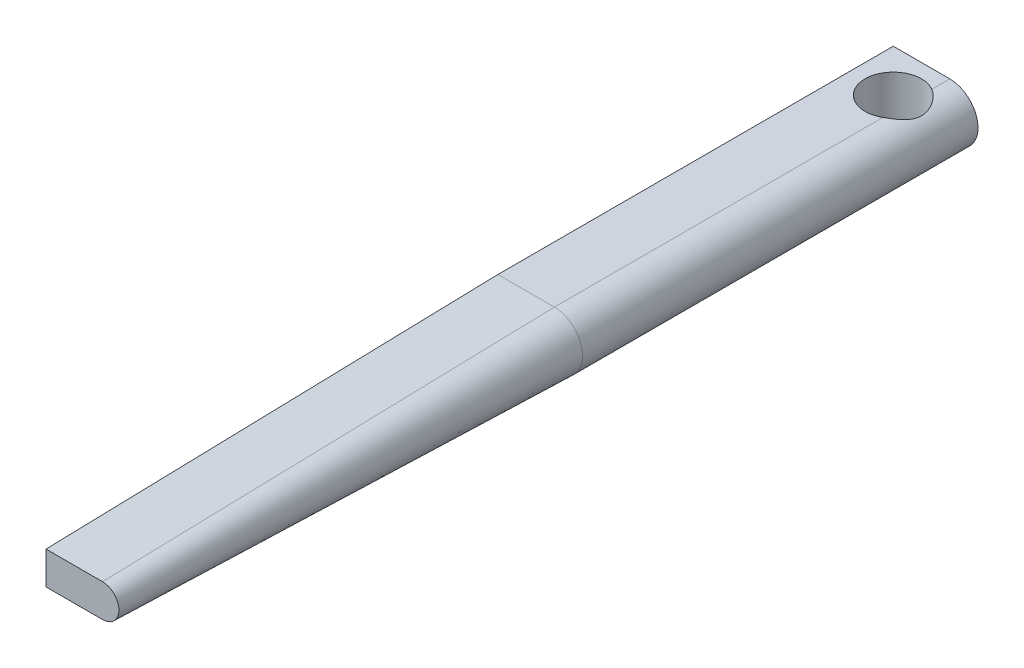
from build123d import *
from OCP.BRepFilletAPI import BRepFilletAPI_MakeChamfer

# Parameters (mm, degrees)
EXTRUDE_1_DEPTH     = 150
SKETCH_2_R          = 5
CUT_EXTRUDE_2_DEPTH = 152.079449297
CHAMFER_1_SIZE      = 80
CHAMFER_1_SIZE2     = 2.094873726


with BuildPart() as part:
    # 草图1 → 拉伸1 (new body)
    with BuildSketch(Plane.XY):
        with BuildLine():
            Line((0, 10), (10, 10))
            ThreePointArc((10, 10), (15, 5), (10, 0))
            Line((10, 0), (0, 0))
            Line((0, 0), (0, 10))
        make_face()
    extrude(amount=EXTRUDE_1_DEPTH)

    # 草图2 → 拉伸2 (cut, through all)
    with BuildSketch(Plane(origin=(0, 10, 0), x_dir=(1, 0, 0), z_dir=(0, 1, 0))):
        with Locations((7.5, -7.5)):
            Circle(SKETCH_2_R)
    extrude(amount=-CUT_EXTRUDE_2_DEPTH, mode=Mode.SUBTRACT)

    # 倒角1: one chamfer whose edges measure the first distance from different faces: ONE call of the kernel's chamfer builder (chamfer() names one face for all edges)
    chamfer_1_edges_1 = [part.edges().sort_by_distance(p)[0] for p in [
        (5, 0, 150),
    ]]
    chamfer_1_side_1 = [part.faces().sort_by_distance(p)[0] for p in [
        (4.927731535, 0, 77.968371884),
    ]]
    chamfer_1_edges_2 = [part.edges().sort_by_distance(p)[0] for p in [
        (15, 5, 150),
    ]]
    chamfer_1_side_2 = [part.faces().sort_by_distance(p)[0] for p in [
        (15, 5, 75),
    ]]
    chamfer_1_edges_3 = [part.edges().sort_by_distance(p)[0] for p in [
        (5, 10, 150),
    ]]
    chamfer_1_side_3 = [part.faces().sort_by_distance(p)[0] for p in [
        (4.927731535, 10, 77.968371884),
    ]]
    chamfer_1 = BRepFilletAPI_MakeChamfer(part.part.solid().wrapped)
    for e in chamfer_1_edges_1:
        chamfer_1.Add(CHAMFER_1_SIZE, CHAMFER_1_SIZE2, e.wrapped, chamfer_1_side_1[0].wrapped)  # the first distance lies on this face
    for e in chamfer_1_edges_2:
        chamfer_1.Add(CHAMFER_1_SIZE, CHAMFER_1_SIZE2, e.wrapped, chamfer_1_side_2[0].wrapped)  # the first distance lies on this face
    for e in chamfer_1_edges_3:
        chamfer_1.Add(CHAMFER_1_SIZE, CHAMFER_1_SIZE2, e.wrapped, chamfer_1_side_3[0].wrapped)  # the first distance lies on this face
    add(Compound.cast(chamfer_1.Shape()), mode=Mode.REPLACE)


solid = part.part
